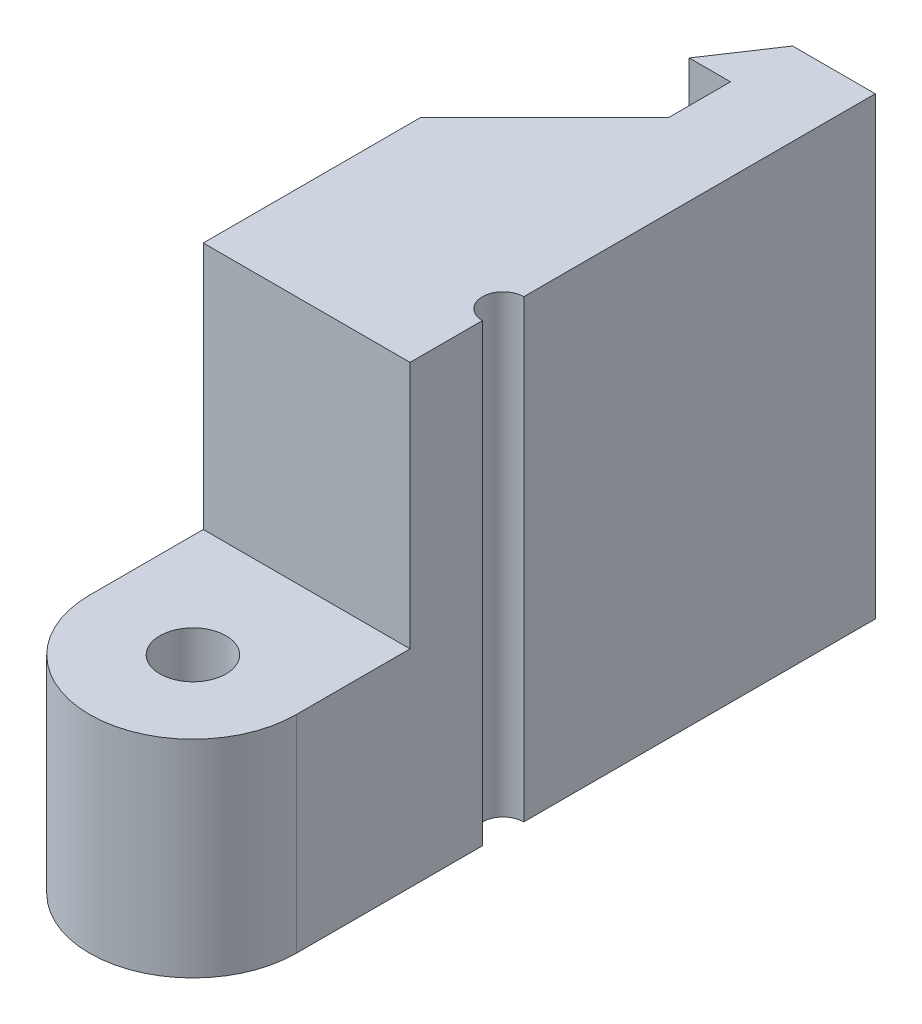
from build123d import *

# Parameters (mm, degrees)
SKETCH1_R           = 1.6
BOSS_EXTRUDE1_DEPTH = 10
BOSS_EXTRUDE2_DEPTH = 12
BOSS_EXTRUDE3_DEPTH = 22
CHAMFER1_SIZE       = 6


with BuildPart() as part:
    # Sketch1 → Boss-Extrude1 (new body)
    with BuildSketch(Plane(origin=(0, 0, 0), x_dir=(1, 0, 0), z_dir=(0, 1, 0))):
        with BuildLine():
            Line((-5, 22), (-5, 0))
            ThreePointArc((-5, 0), (0, -5), (5, 0))
            Line((5, 0), (5, 9))
            ThreePointArc((5, 9), (4, 10), (5, 11))
            Line((5, 11), (5, 22))
            Line((5, 22), (-5, 22))
        make_face()
        with Locations(Location((0, 0, 0), (0, 0, 270))):
            Circle(SKETCH1_R, mode=Mode.SUBTRACT)
    extrude(amount=BOSS_EXTRUDE1_DEPTH)

    # Sketch3 → Boss-Extrude2 (add)
    with BuildSketch(Plane(origin=(0, 10, 0), x_dir=(1, 0, 0), z_dir=(0, 1, 0))):
        with BuildLine():
            Line((5, 5.5), (-5, 5.5))
            Line((-5, 5.5), (-5, 22))
            Line((-5, 22), (5, 22))
            Line((5, 22), (5, 11))
            ThreePointArc((5, 11), (4, 10), (5, 9))
            Line((5, 9), (5, 5.5))
        make_face()
    extrude(amount=BOSS_EXTRUDE2_DEPTH)

    # Sketch5 → Boss-Extrude3 (add)
    with BuildSketch(Plane(origin=(0, 22, 0), x_dir=(1, 0, 0), z_dir=(0, 1, 0))):
        Polygon((5, 22), (5, 28), (1, 28), (-1, 25), (1, 25), (1, 22), align=None)
    extrude(amount=-BOSS_EXTRUDE3_DEPTH)

    # Chamfer1
    chamfer1_edges = [part.edges().sort_by_distance(p)[0] for p in [
        (-5, 11, -22),
    ]]
    chamfer(chamfer1_edges, length=CHAMFER1_SIZE - 0.0001)  # a hair under: the kernel refuses the full size


solid = part.part
